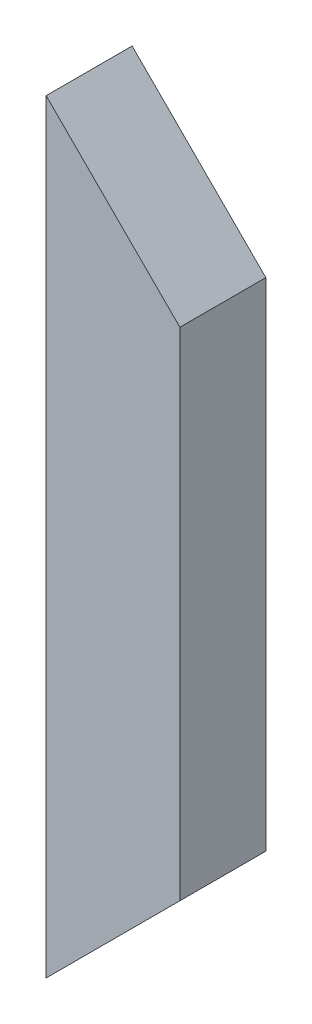
from build123d import *

# Parameters (mm, degrees)
SKETCH1_W          = 70
SKETCH1_H          = 45
SHAPE_DEPTH        = 400
CUT_EXTRUDE1_REACH = 406.042


with BuildPart() as part:
    # Sketch1 → Shape (new body)
    with BuildSketch(Plane(origin=(0, 0, 0), x_dir=(1, 0, 0), z_dir=(0, 1, 0))):
        Rectangle(SKETCH1_W, SKETCH1_H)
    extrude(amount=SHAPE_DEPTH)

    # Sketch2 → Cut-Extrude1 (cut, up to next)
    with BuildSketch(Plane.XY.offset(22.5), mode=Mode.PRIVATE) as cut_extrude1_sk1:
        Polygon((35, 400), (-35, 400), (35, 330), align=None)
    cut_extrude1_tool1 = extrude(cut_extrude1_sk1.sketch, amount=-CUT_EXTRUDE1_REACH, mode=Mode.PRIVATE) & part.part
    # Sketch2 → Cut-Extrude1 (cut, up to next)
    with BuildSketch(Plane.XY.offset(22.5), mode=Mode.PRIVATE) as cut_extrude1_sk2:
        Polygon((35, 70), (-35, 0), (35, 0), align=None)
    cut_extrude1_tool2 = extrude(cut_extrude1_sk2.sketch, amount=-CUT_EXTRUDE1_REACH, mode=Mode.PRIVATE) & part.part
    add(cut_extrude1_tool1.solids().sort_by_distance((11.666667, 376.666667, 22.5))[0], mode=Mode.SUBTRACT)
    add(cut_extrude1_tool2.solids().sort_by_distance((11.666667, 23.333333, 22.5))[0], mode=Mode.SUBTRACT)


solid = part.part
